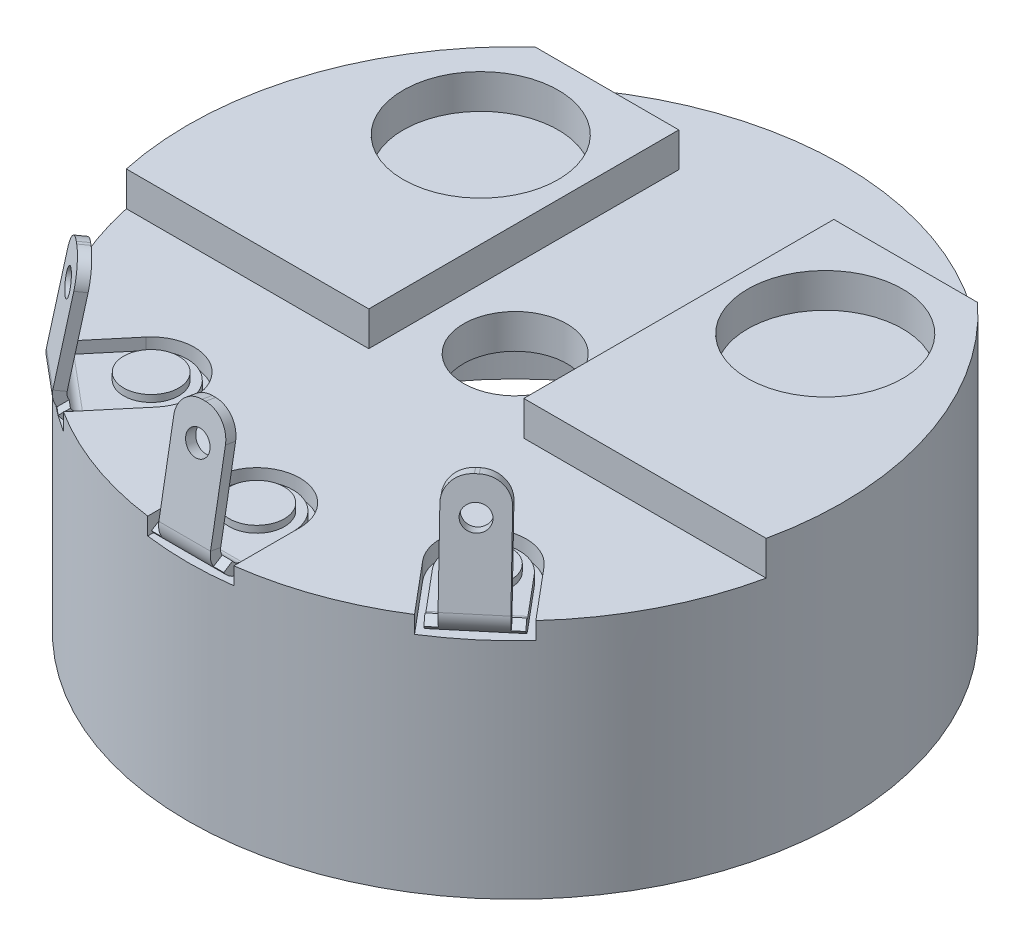
from build123d import *
from build123d.topology import SkipClean

# Parameters (mm, degrees)
SKETCH1_R                  = 4.75
SKETCH1_R_2                = 0.75
BOSS_EXTRUDE1_DEPTH        = 0.5
BOSS_EXTRUDE3_START        = 0.5
SKETCH1_4_R                = 1.125
BOSS_EXTRUDE3_DEPTH        = 0.5
SKETCH3_R                  = 0.375
CUT_EXTRUDE1_DEPTH         = 7.736096793
CUT_EXTRUDE2_START         = -0.25
SKETCH3_3_R                = 0.375
CUT_EXTRUDE2_DEPTH         = 0.25
CIRPATTERN1_COUNT          = 3
CIRPATTERN1_ANGLE          = 80
EXTRUDE_THIN1_START        = -3
SKETCH1_5_R                = 4.75
SKETCH1_5_R_2              = 4.5
EXTRUDE_THIN1_DEPTH        = 3
BASE_FLANGE1_START         = 0.15
SKETCH4_R                  = 0.375
SKETCH4_R_2                = 0.175
BASE_FLANGE1_DEPTH         = 0.15
SKETCHED_START             = -0.525
SKETCHED_BEND1_DEPTH       = 1.05
SKETCHED_BEND1_2_DEPTH     = 1.05
SKETCHED_START_2           = -0.375
SKETCHED_BEND1_3_DEPTH     = 0.75
SKETCHED_START_3           = -4.828299493
SKETCHED_BEND1_4_OUTLINE_R = 0.175
SKETCHED_BEND1_4_DEPTH     = 0.149999999
SKETCH10_R                 = 0.375
BASE_FLANGE2_DEPTH         = 0.15
CIRPATTERN2_COUNT          = 3
CIRPATTERN2_ANGLE          = 80


with BuildPart() as part:
    # Sketch1 → Boss-Extrude1 (new body)
    with BuildSketch(Plane(origin=(0, 0, 0), x_dir=(1, 0, 0), z_dir=(0, 1, 0))):
        with Locations(Location((0, 0, 0), (0, 0, 270))):
            Circle(SKETCH1_R)
        with Locations(Location((0, 0, 0), (0, 0, 270))):
            Circle(SKETCH1_R_2, mode=Mode.SUBTRACT)
    extrude(amount=BOSS_EXTRUDE1_DEPTH)

    # Sketch1<4> → Boss-Extrude3 (add)
    # profile 1 of 2: a face of its own
    with BuildSketch(Plane(origin=(0, 0, 0), x_dir=(1, 0, 0), z_dir=(0, 1, 0)).offset(BOSS_EXTRUDE3_START)):
        with BuildLine():
            ThreePointArc((-3.211308145, 3.5), (-4.526276083, 1.440598771), (-4.643543905, -1))
            Line((-4.643543905, -1), (-1.125, -1))
            Line((-1.125, -1), (-1.125, 3.5))
            Line((-1.125, 3.5), (-3.211308145, 3.5))
        make_face()
        with Locations(Location((-2.5, 2, 0), (0, 0, 270))):
            Circle(SKETCH1_4_R, mode=Mode.SUBTRACT)
    # profile 2 of 2: a face of its own
    with BuildSketch(Plane(origin=(0, 0, 0), x_dir=(1, 0, 0), z_dir=(0, 1, 0)).offset(BOSS_EXTRUDE3_START)):
        with BuildLine():
            Line((1.125, -1), (4.643543905, -1))
            ThreePointArc((4.643543905, -1), (4.723310997, -0.502825243), (4.75, 0))
            ThreePointArc((4.75, 0), (4.348345299, 1.911646713), (3.211308145, 3.5))
            Line((3.211308145, 3.5), (1.125, 3.5))
            Line((1.125, 3.5), (1.125, -1))
        make_face()
        with Locations(Location((2.5, 2, 0), (0, 0, 270))):
            Circle(SKETCH1_4_R, mode=Mode.SUBTRACT)
    extrude(amount=BOSS_EXTRUDE3_DEPTH)

    # Sketch3 → Cut-Extrude1 (cut, through all)
    with BuildSketch(Plane(origin=(0, 0.5, 0), x_dir=(1, 0, 0), z_dir=(0, 1, 0))):
        with Locations(Location((-2.410453536, -2.872666662, 0), (0, 0, 270))):
            Circle(SKETCH3_R)
    cut_extrude1 = extrude(amount=-CUT_EXTRUDE1_DEPTH, mode=Mode.SUBTRACT)

    # Sketch3<3> → Cut-Extrude2 (cut)
    with BuildSketch(Plane(origin=(0, 0.5, 0), x_dir=(1, 0, 0), z_dir=(0, 1, 0)).offset(CUT_EXTRUDE2_START)):
        with BuildLine():
            Line((-3.505473113, -3.205332784), (-2.889231313, -2.470924406))
            ThreePointArc((-2.889231313, -2.470924406), (-2.00871128, -2.393888885), (-1.931675759, -3.274408918))
            Line((-1.931675759, -3.274408918), (-2.547917559, -4.008817296))
            ThreePointArc((-2.547917559, -4.008817296), (-3.053241146, -3.638711105), (-3.505473113, -3.205332784))
        make_face()
        with Locations(Location((-2.410453536, -2.872666662, 0), (0, 0, 270))):
            Circle(SKETCH3_3_R, mode=Mode.SUBTRACT)
    cut_extrude2 = extrude(amount=CUT_EXTRUDE2_DEPTH, mode=Mode.SUBTRACT)

    # CirPattern1: Cut-Extrude1, Cut-Extrude2 ×3 about axis
    cirpattern1_axis = Axis((0, 0, 0), (0, 1, 0))
    add([cut_extrude1.rotate(cirpattern1_axis, i * CIRPATTERN1_ANGLE / (CIRPATTERN1_COUNT - 1)) for i in range(1, CIRPATTERN1_COUNT)], mode=Mode.SUBTRACT)
    add([cut_extrude2.rotate(cirpattern1_axis, i * CIRPATTERN1_ANGLE / (CIRPATTERN1_COUNT - 1)) for i in range(1, CIRPATTERN1_COUNT)], mode=Mode.SUBTRACT)

    # Sketch1<5> → Extrude-Thin1 (add)
    with BuildSketch(Plane(origin=(0, 0, 0), x_dir=(1, 0, 0), z_dir=(0, 1, 0)).offset(EXTRUDE_THIN1_START)):
        Circle(SKETCH1_5_R)
        Circle(SKETCH1_5_R_2, mode=Mode.SUBTRACT)
    extrude(amount=EXTRUDE_THIN1_DEPTH)


with BuildPart() as body_2:
    # Base-Flange1: sheet metal written as solids
    # Sketch4 → Base-Flange1 (new body)
    with BuildSketch(Plane(origin=(0, 0.25, 0), x_dir=(1, 0, 0), z_dir=(0, 1, 0)).offset(BASE_FLANGE1_START)):
        with BuildLine():
            Line((-3.313962002, -3.366029686), (-3.428868668, -3.269611545))
            Line((-3.428868668, -3.269611545), (-2.812626869, -2.535203167))
            ThreePointArc((-2.812626869, -2.535203167), (-2.072990041, -2.470493329), (-2.008280204, -3.210130157))
            Line((-2.008280204, -3.210130157), (-2.624522003, -3.944538535))
            Line((-2.624522003, -3.944538535), (-2.73942867, -3.848120394))
            Line((-2.73942867, -3.848120394), (-3.639331323, -4.920582614))
            ThreePointArc((-3.639331323, -4.920582614), (-3.876942368, -5.044275095), (-4.132422542, -4.963722506))
            Line((-4.132422542, -4.963722506), (-4.170724764, -4.931583125))
            ThreePointArc((-4.170724764, -4.931583125), (-4.294417245, -4.69397208), (-4.213864655, -4.438491907))
            Line((-4.213864655, -4.438491907), (-3.313962002, -3.366029686))
        make_face()
        with Locations(Location((-2.410453536, -2.872666662, 0), (0, 0, 270))):
            Circle(SKETCH4_R, mode=Mode.SUBTRACT)
        with Locations(Location((-3.830179848, -4.564630594, 0), (0, 0, 270))):
            Circle(SKETCH4_R_2, mode=Mode.SUBTRACT)
    extrude(amount=-BASE_FLANGE1_DEPTH)

    # Sketched Bend1: read off the stored shape, not the designer's step
    # Sketched Bend1 outline → Sketched Bend1 (cut)
    with BuildSketch(Plane(origin=(0, 0, 0), x_dir=(0.6427876096865348, 0, -0.7660444431189818), z_dir=(0.7660444431189818, 0, 0.6427876096865349)).offset(SKETCHED_START)):
        with BuildLine():
            Line((-4.760983594, 0.4), (-6.45870205, 0.4))
            Line((-6.45870205, 0.4), (-6.45870205, 0.25))
            Line((-6.45870205, 0.25), (-4.501175973, 0.25))
            ThreePointArc((-4.501175973, 0.25), (-4.651175973, 0.290192379), (-4.760983594, 0.4))
        make_face()
    extrude(amount=SKETCHED_BEND1_DEPTH, mode=Mode.SUBTRACT)

    # Sketched Bend1 2 outline → Sketched Bend1 2 (add)
    with SkipClean():  # the faces are left unmerged after this step: merging them gives an invalid solid
        with BuildSketch(Plane(origin=(0, 0, 0), x_dir=(0.6427876096865348, 0, -0.7660444431189818), z_dir=(0.7660444431189818, 0, 0.6427876096865349)).offset(SKETCHED_START)):
            with BuildLine():
                ThreePointArc((-4.501175973, 0.4), (-4.57325702, 0.418454105), (-4.627602184, 0.469275698))
                Line((-4.627602184, 0.469275698), (-4.754028396, 0.388551395))
                ThreePointArc((-4.754028396, 0.388551395), (-4.73301345, 0.359602037), (-4.70870205, 0.333359913))
                Line((-4.70870205, 0.333359913), (-4.70870205, 0.4))
                Line((-4.70870205, 0.4), (-4.501175973, 0.4))
            make_face()
        extrude(amount=SKETCHED_BEND1_2_DEPTH)

    # Sketched Bend1 3 outline → Sketched Bend1 3 (add)
    with SkipClean():  # the faces are left unmerged after this step: merging them gives an invalid solid
        with BuildSketch(Plane(origin=(0, 0, 0), x_dir=(0.6427876096865348, 0, -0.7660444431189818), z_dir=(0.7660444431189818, 0, 0.6427876096865349)).offset(SKETCHED_START_2)):
            with BuildLine():
                ThreePointArc((-4.627602184, 0.469275698), (-4.648278779, 0.520661214), (-4.648897136, 0.576047227))
                Line((-4.648897136, 0.576047227), (-4.371712461, 2.148039633))
                Line((-4.371712461, 2.148039633), (-4.519433624, 2.174086859))
                Line((-4.519433624, 2.174086859), (-4.796618299, 0.602094453))
                ThreePointArc((-4.796618299, 0.602094453), (-4.796618299, 0.497905546), (-4.760983594, 0.4))
                Line((-4.760983594, 0.4), (-4.736098185, 0.4))
                Line((-4.736098185, 0.4), (-4.627602184, 0.469275698))
            make_face()
        extrude(amount=SKETCHED_BEND1_3_DEPTH)

    # Sketched Bend1 4 outline → Sketched Bend1 4 (cut)
    with SkipClean():  # the faces are left unmerged after this step: merging them gives an invalid solid
        with BuildSketch(Plane(origin=(0, 0, 0), x_dir=(0.7741336234862138, 0.1419950663058057, 0.6168910228986272), z_dir=(0.6330222215594842, -0.17364817766693405, -0.7544065067354924)).offset(SKETCHED_START_3)):
            with BuildLine():
                Line((-0.175527489, -1.396163693), (0.170815245, -1.345698743))
                ThreePointArc((0.170815245, -1.345698743), (-0.088866892, -1.279941413), (-0.225992438, -1.049820959))
                Line((-0.225992438, -1.049820959), (-0.175527489, -1.396163693))
            make_face()
            with BuildLine():
                ThreePointArc((0.516170562, -0.941681782), (0.450413232, -1.201363919), (0.220292778, -1.338489465))
                Line((0.220292778, -1.338489465), (0.566635511, -1.288024516))
                Line((0.566635511, -1.288024516), (0.516170562, -0.941681782))
            make_face()
            with Locations((0.123461227, -0.847318771)):
                Circle(SKETCHED_BEND1_4_OUTLINE_R)
        extrude(amount=SKETCHED_BEND1_4_DEPTH, mode=Mode.SUBTRACT)


with BuildPart() as body_3:
    # Base-Flange2: sheet metal written as solids
    # Sketch10 → Base-Flange2 (new body)
    with BuildSketch(Plane.XZ):
        with BuildLine():
            ThreePointArc((-2.828265483, 3.37059555), (0, -4.4), (2.828265483, 3.37059555))
            ThreePointArc((2.828265483, 3.37059555), (1.912524648, 3.290478608), (1.99264159, 2.374737774))
            ThreePointArc((1.99264159, 2.374737774), (0, -3.1), (-1.99264159, 2.374737774))
            ThreePointArc((-1.99264159, 2.374737774), (-1.912524648, 3.290478608), (-2.828265483, 3.37059555))
        make_face()
        with Locations(Location((-2.410453536, 2.872666662, 0), (0, 0, 270))):
            Circle(SKETCH10_R, mode=Mode.SUBTRACT)
        with Locations(Location((2.410453536, 2.872666662, 0), (0, 0, 270))):
            Circle(SKETCH10_R, mode=Mode.SUBTRACT)
    extrude(amount=BASE_FLANGE2_DEPTH)


with BuildPart() as body_4:
    # Sketch14 → Revolve1 (revolve)
    with BuildSketch(Plane(origin=(0, 0, 0), x_dir=(-0.6427876096865347, 0, 0.7660444431189819), z_dir=(-0.7660444431189819, 0, -0.6427876096865347)), mode=Mode.PRIVATE) as revolve1_sk:
        Polygon((3.375, 0.4), (3.35, 0.4), (3.35, 0.5), (3.75, 0.5), (3.75, -0.25), (3.35, -0.25), (3.35, -0.15), (3.375, -0.15), align=None)
    revolve(revolve1_sk.sketch.rotate(Axis((-2.410453536, 0.5, 2.872666662), (0, -1, 0)), 140), axis=Axis((-2.410453536, 0.5, 2.872666662), (0, -1, 0)))


with BuildPart() as cirpattern2_1:
    # CirPattern2: pattern copy
    add(body_2.part.rotate(Axis((0, 0, 0), (0, 1, 0)), 1 * CIRPATTERN2_ANGLE / (CIRPATTERN2_COUNT - 1)))


with BuildPart() as cirpattern2_2:
    # CirPattern2: pattern copy
    add(body_2.part.rotate(Axis((0, 0, 0), (0, 1, 0)), 2 * CIRPATTERN2_ANGLE / (CIRPATTERN2_COUNT - 1)))


with BuildPart() as cirpattern2_3:
    # CirPattern2: pattern copy
    add(body_4.part.rotate(Axis((0, 0, 0), (0, 1, 0)), 1 * CIRPATTERN2_ANGLE / (CIRPATTERN2_COUNT - 1)))


with BuildPart() as cirpattern2_4:
    # CirPattern2: pattern copy
    add(body_4.part.rotate(Axis((0, 0, 0), (0, 1, 0)), 2 * CIRPATTERN2_ANGLE / (CIRPATTERN2_COUNT - 1)))


solid = Compound([part.part, body_2.part, body_3.part, body_4.part, cirpattern2_1.part, cirpattern2_2.part, cirpattern2_3.part, cirpattern2_4.part])
